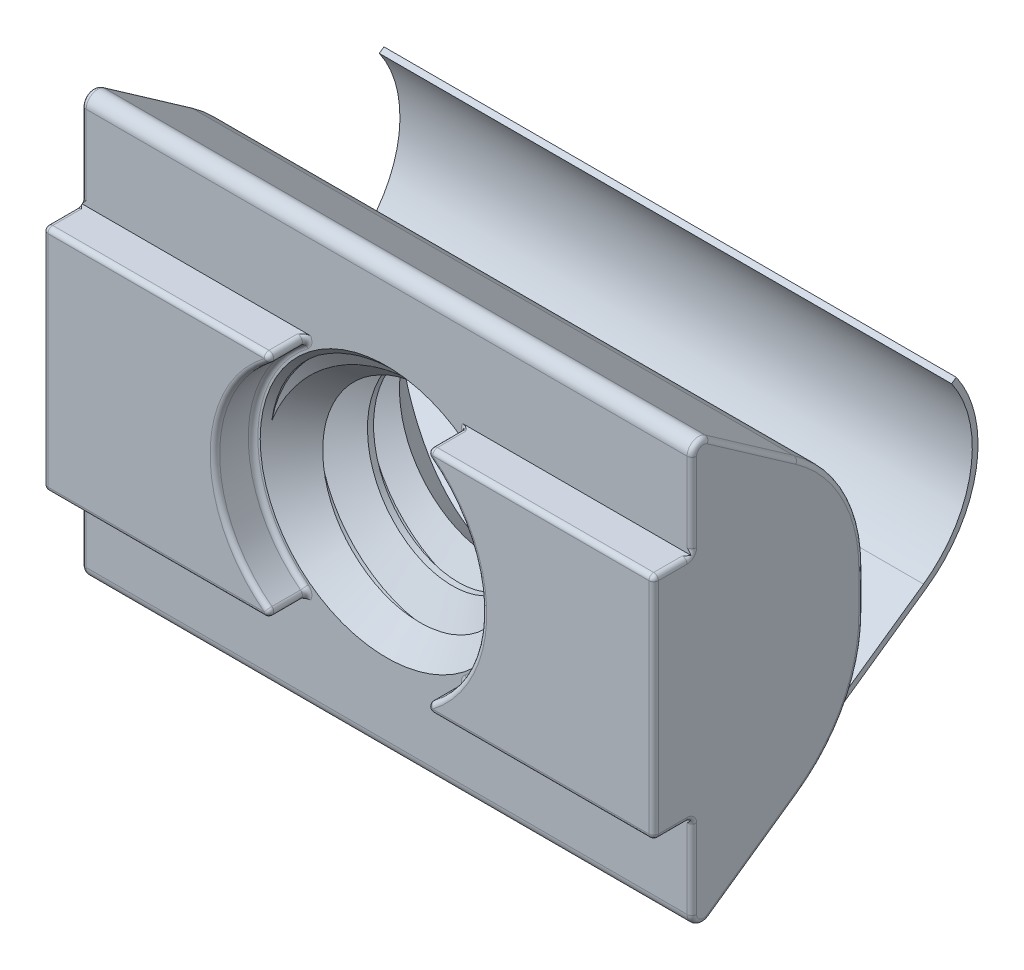
from build123d import *

# Parameters (mm, degrees)
BOSS_EXTRUDE1_DEPTH          = 8
BOSS_EXTRUDE1_DEPTH_BACK     = 8
SKETCH5_R                    = 3.5
CUT_EXTRUDE1_DEPTH           = 1
SKETCH6_R                    = 3.175
CUT_EXTRUDE2_DEPTH           = 12.157956802
BOSS_EXTRUDE2_DEPTH          = 7.5
BOSS_EXTRUDE2_DEPTH_BACK     = 7.5
FILLET2_R                    = 0.125
FILLET3_R                    = 0.125
SWEEP1_PITCH                 = 1.27
SKETCH13_R                   = 3.312481533
CUT_EXTRUDE4_OTHER_WAY_DEPTH = 13.601274113
SKETCH14_OUTSIDE_W           = 15.286
SKETCH14_OUTSIDE_H           = 17.335
CUT_EXTRUDE5_DEPTH           = 19.051443457


with BuildPart() as part:
    # Sketch4 → Boss-Extrude1 (new, two sides: drawn at the far end of the back side and taken through both)
    with BuildSketch(Plane(origin=(0, 0, 0), x_dir=(0, 0, -1), z_dir=(1, 0, 0)).offset(-BOSS_EXTRUDE1_DEPTH_BACK)):
        with BuildLine():
            Line((-1.277927069, -5.445745613), (1.044305745, -3.819700691))
            ThreePointArc((1.044305745, -3.819700691), (2.298043333, -2.390086967), (2.75, -0.543092514))
            Line((2.75, -0.543092514), (2.75, 0.543092514))
            ThreePointArc((2.75, 0.543092514), (2.298043333, 2.390086967), (1.044305745, 3.819700691))
            Line((1.044305745, 3.819700691), (-1.277927069, 5.445745613))
            ThreePointArc((-1.277927069, 5.445745613), (-1.588524584, 5.46610325), (-1.75, 5.2))
            Line((-1.75, 5.2), (-1.75, 3))
            Line((-1.75, 3), (-2.75, 3))
            Line((-2.75, 3), (-2.75, -3))
            Line((-2.75, -3), (-1.75, -3))
            Line((-1.75, -3), (-1.75, -5.2))
            ThreePointArc((-1.75, -5.2), (-1.588524584, -5.46610325), (-1.277927069, -5.445745613))
        make_face()
    extrude(amount=BOSS_EXTRUDE1_DEPTH + BOSS_EXTRUDE1_DEPTH_BACK)

    # Sketch5 → Cut-Extrude1 (cut)
    with BuildSketch(Plane.XY.offset(2.75)):
        Circle(SKETCH5_R)
    extrude(amount=-CUT_EXTRUDE1_DEPTH, mode=Mode.SUBTRACT)

    # Sketch6 → Cut-Extrude2 (cut, through all)
    with BuildSketch(Plane.XY.offset(2.75)):
        with Locations(Location((0, 0, 0), (0, 0, 350.150965604))):
            Circle(SKETCH6_R)
    extrude(amount=-CUT_EXTRUDE2_DEPTH, mode=Mode.SUBTRACT)

    # Fillet2
    fillet2_edges = [part.edges().sort_by_distance(p)[0] for p in [
        (1.802775638, -3, 2.25),
        (-1.802775638, -3, 2.25),
        (-1.802775638, 3, 2.25),
        (1.802775638, 3, 2.25),
    ]]
    fillet(fillet2_edges, radius=FILLET2_R)

    # Fillet3
    fillet3_edges = [part.edges().sort_by_distance(p)[0] for p in [
        (-8, -2.390086967, -2.298043333),
        (2.089582197, -2.91520422, 1.75),
        (2.089582197, 2.91520422, 1.75),
        (-2.089582197, 2.91520422, 1.75),
        (-8, 0, -2.75),
        (-8, 2.390086967, -2.298043333),
        (-8, 4.632723152, 0.116810662),
        (-5.103970108, -3, 1.75),
        (-5.103970108, -3, 2.75),
        (-5.103970108, 3, 2.75),
        (-5.103970108, 3, 1.75),
        (-8, 5.46610325, 1.588524584),
        (-8, 4.1, 1.75),
        (-8, 3, 2.25),
        (-8, 0, 2.75),
        (8, -5.46610325, 1.588524584),
        (8, -4.632723152, 0.116810662),
        (8, -2.390086967, -2.298043333),
        (-8, -3, 2.25),
        (8, 0, -2.75),
        (8, 2.390086967, -2.298043333),
        (8, 4.632723152, 0.116810662),
        (8, 5.46610325, 1.588524584),
        (8, 4.1, 1.75),
        (8, 3, 2.25),
        (8, 0, 2.75),
        (8, -3, 2.25),
        (8, -4.1, 1.75),
        (-8, -4.1, 1.75),
        (-8, -5.46610325, 1.588524584),
        (-8, -4.632723152, 0.116810662),
        (-3.5, 0, 1.75),
        (-3.5, 0, 2.75),
        (-2.089582197, 2.91520422, 2.75),
        (-2.089582197, -2.91520422, 2.75),
        (3.5, 0, 2.75),
        (3.5, 0, 1.75),
        (5.103970108, -3, 2.75),
        (5.103970108, 3, 2.75),
        (2.089582197, 2.91520422, 2.75),
        (2.089582197, -2.91520422, 2.75),
        (5.103970108, -3, 1.75),
        (5.103970108, 3, 1.75),
        (-2.089582197, -2.91520422, 1.75),
    ]]
    fillet(fillet3_edges, radius=FILLET3_R)

    # Sweep1: the profile of Sketch12 screwed along a right-hand helix of 5.330709 turns, 8 arcs to a turn; built about Z, then put on its axis
    sweep1_z = Axis((0, 0, 0), (0, 0, 1))
    sweep1_corners = [(2.350110803, 0, -0.635), (2.350110803, 0, -0.47625), (3.243740766, 0, 0.0396875), (3.243740766, 0, -1.1509375)]
    with BuildLine(mode=Mode.PRIVATE) as sweep1_profile:
        Line(sweep1_corners[0], sweep1_corners[1])
        Line(sweep1_corners[1], sweep1_corners[2])
        Line(sweep1_corners[2], sweep1_corners[3])
        Line(sweep1_corners[3], sweep1_corners[0])
    sweep1_cap = Face(sweep1_profile.wire())
    sweep1_turn_angles = [0, 22.5, 45, 67.5, 90, 112.5, 135, 157.5, 180, 202.5, 225, 247.5, 270, 292.5, 315, 337.5, 360]
    sweep1_turn_weights = [1, 0.9238795325112867, 1, 0.9238795325112867, 1, 0.9238795325112867, 1, 0.9238795325112867, 1, 0.9238795325112867, 1, 0.9238795325112867, 1, 0.9238795325112867, 1, 0.9238795325112867, 1]
    sweep1_turn_rails = [Edge.make_bspline([Vector(p[0], p[1], 0).rotate(sweep1_z, sweep1_turn_angles[k]) / sweep1_turn_weights[k] + Vector(0, 0, p[2] + SWEEP1_PITCH * sweep1_turn_angles[k] / 360) for k in range(17)], [0, 0, 0, 1, 1, 2, 2, 3, 3, 4, 4, 5, 5, 6, 6, 7, 7, 8, 8, 8], 2, sweep1_turn_weights) for p in sweep1_corners]
    sweep1_turn_sides = [Face.make_surface_from_curves(sweep1_turn_rails[p[0]], sweep1_turn_rails[p[1]]) for p in [(0, 1), (1, 2), (2, 3), (3, 0)]]
    sweep1_last_angles = [1800, 1822.5, 1845, 1867.5, 1890, 1904.527559055, 1919.05511811]
    sweep1_last_weights = [1, 0.9238795325112867, 1, 0.9238795325112867, 1, 0.968027096545523, 1]
    sweep1_last_rails = [Edge.make_bspline([Vector(p[0], p[1], 0).rotate(sweep1_z, sweep1_last_angles[k]) / sweep1_last_weights[k] + Vector(0, 0, p[2] + SWEEP1_PITCH * sweep1_last_angles[k] / 360) for k in range(7)], [0, 0, 0, 1, 1, 2, 2, 3, 3, 3], 2, sweep1_last_weights) for p in sweep1_corners]
    sweep1_last_sides = [Face.make_surface_from_curves(sweep1_last_rails[p[0]], sweep1_last_rails[p[1]]) for p in [(0, 1), (1, 2), (2, 3), (3, 0)]]
    sweep1 = Plane(origin=(0, 0, 2.75), x_dir=(0, 1, 0), z_dir=(0, 0, -1)) * Solid(Shell([*[p.moved(Location((0, 0, SWEEP1_PITCH * i))) for i in range(5) for p in sweep1_turn_sides], *sweep1_last_sides, sweep1_cap, sweep1_cap.rotate(sweep1_z, 1919.05511811).moved(Location((0, 0, SWEEP1_PITCH * 1919.05511811 / 360)))]))
    add(sweep1)

    # Cut-Extrude4 cone 1 section (through the dimple's axis) → Cut-Extrude4 (revolve, cut)
    with BuildSketch(Plane(origin=(0, 0, 1.75), x_dir=(0, -1, 0), z_dir=(1, 0, 0))):
        Polygon((0, 0), (3.312481533, 0), (0, 3.312481533), align=None)
    revolve(axis=Axis((0, 0, 1.75), (0, 0, -1)), mode=Mode.SUBTRACT)

    # Sketch13 → Cut-Extrude4 other way (cut)
    with BuildSketch(Plane.XY.offset(1.75)):
        Circle(SKETCH13_R)
    extrude(amount=CUT_EXTRUDE4_OTHER_WAY_DEPTH, mode=Mode.SUBTRACT)

    # Sketch14 outside → Cut-Extrude5 (cut, through all)
    with BuildSketch(Plane(origin=(8, 0, 0), x_dir=(0, 0, -1), z_dir=(1, 0, 0))):
        with Locations((1.75, -0.0245)):
            Rectangle(SKETCH14_OUTSIDE_W, SKETCH14_OUTSIDE_H)
        with BuildLine():
            Line((-1.277927069, -5.445745613), (1.044305745, -3.819700691))
            ThreePointArc((1.044305745, -3.819700691), (2.298043333, -2.390086967), (2.75, -0.543092514))
            Line((2.75, -0.543092514), (2.75, 0.543092514))
            ThreePointArc((2.75, 0.543092514), (2.298043333, 2.390086967), (1.044305745, 3.819700691))
            Line((1.044305745, 3.819700691), (-1.277927069, 5.445745613))
            ThreePointArc((-1.277927069, 5.445745613), (-1.588524584, 5.46610325), (-1.75, 5.2))
            Line((-1.75, 5.2), (-1.75, 3))
            Line((-1.75, 3), (-2.75, 3))
            Line((-2.75, 3), (-2.75, -3))
            Line((-2.75, -3), (-1.75, -3))
            Line((-1.75, -3), (-1.75, -5.2))
            ThreePointArc((-1.75, -5.2), (-1.588524584, -5.46610325), (-1.277927069, -5.445745613))
        make_face(mode=Mode.SUBTRACT)
    extrude(amount=-CUT_EXTRUDE5_DEPTH, mode=Mode.SUBTRACT)

    # Sketch16 → Cut-Revolve1 (revolve, cut)
    with BuildSketch(Plane(origin=(0, 0, 0), x_dir=(0, 0, -1), z_dir=(1, 0, 0)), mode=Mode.PRIVATE) as cut_revolve1_sk:
        Polygon((2.75, 0), (2.75, 4.16284745), (0, 1.41284745), (0, 0), align=None)
    revolve(cut_revolve1_sk.sketch.rotate(Axis((0, 0, 0), (0, 0, -1)), 90), axis=Axis((0, 0, 0), (0, 0, -1)), mode=Mode.SUBTRACT)


with BuildPart() as body_2:
    # Sketch7 → Boss-Extrude2 (new, two sides: drawn at the far end of the back side and taken through both)
    with BuildSketch(Plane(origin=(0, 0, 0), x_dir=(0, 0, -1), z_dir=(1, 0, 0)).offset(-BOSS_EXTRUDE2_DEPTH_BACK)):
        with BuildLine():
            Line((-1.163963535, -5.549063676), (-1.25, -5.426190869))
            Line((-1.25, -5.426190869), (4.820729309, -1.175420444))
            ThreePointArc((4.820729309, -1.175420444), (6.054423259, 0.761091156), (5.557456133, 3.002764998))
            Line((5.557456133, 3.002764998), (5.68032894, 3.088801463))
            ThreePointArc((5.68032894, 3.088801463), (6.202144422, 0.735043929), (4.906765775, -1.298293251))
            Line((4.906765775, -1.298293251), (-1.163963535, -5.549063676))
        make_face()
    extrude(amount=BOSS_EXTRUDE2_DEPTH + BOSS_EXTRUDE2_DEPTH_BACK)


solid = Compound([part.part, body_2.part])
